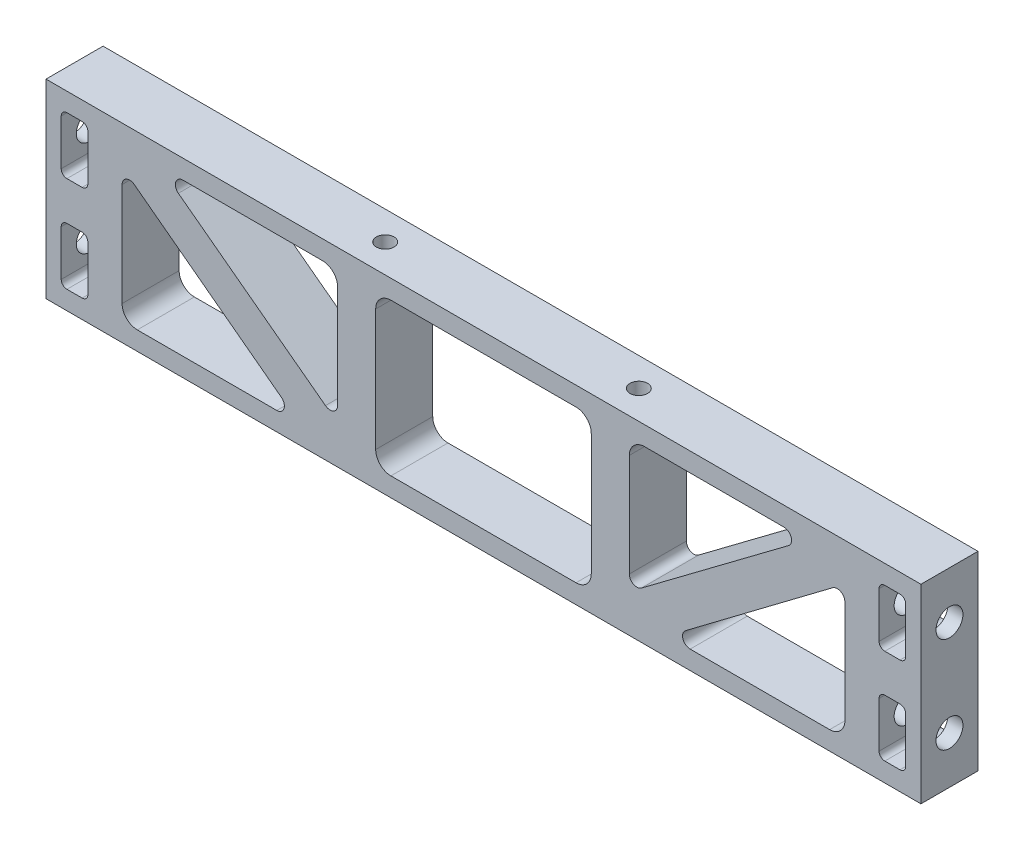
from build123d import *

# Parameters (mm, degrees)
BOSS_EXTRUDE2_DEPTH                        = 9.525
SKETCH3_R                                  = 2.2479
CUT_EXTRUDE1_DEPTH                         = 11.1125
MIRROR1_AT_THE_SECOND_PLANE_COPY_1_SKETC_R = 2.2479
MIRROR1_AT_THE_SECOND_PLANE_COPY_1_DEPTH   = 11.1125
SKETCH4_R                                  = 1.4732
CUT_EXTRUDE2_DEPTH                         = 12.7
MIRROR2_AT_THE_SECOND_PLANE_COPY_1_SKETC_R = 1.4732
MIRROR2_AT_THE_SECOND_PLANE_COPY_1_DEPTH   = 12.7


with BuildPart() as part:
    # Sketch2 → Boss-Extrude2 (new body)
    with BuildSketch(Plane.XY):
        Polygon((-63.5, 15.875), (-73.025, 15.875), (-73.025, -15.875), (-63.5, -15.875), (-21.166666667, -15.875), (0, -15.875), (73.025, -15.875), (73.025, 15.875), (-21.166666667, 15.875), (-24.341666667, 15.875), align=None)
        with BuildLine():
            Line((-66.04, -4.19), (-66.04, -11.81))
            ThreePointArc((-66.04, -11.81), (-66.318980791, -12.483519209), (-66.9925, -12.7625))
            Line((-66.9925, -12.7625), (-69.5325, -12.7625))
            ThreePointArc((-69.5325, -12.7625), (-70.206019209, -12.483519209), (-70.485, -11.81))
            Line((-70.485, -11.81), (-70.485, -4.19))
            ThreePointArc((-70.485, -4.19), (-70.206019209, -3.516480791), (-69.5325, -3.2375))
            Line((-69.5325, -3.2375), (-66.9925, -3.2375))
            ThreePointArc((-66.9925, -3.2375), (-66.318980791, -3.516480791), (-66.04, -4.19))
        make_face(mode=Mode.SUBTRACT)
        with BuildLine():
            ThreePointArc((-57.785, -12.7625), (-59.581051224, -12.018551224), (-60.325, -10.2225))
            Line((-60.325, -10.2225), (-60.325, 6.985))
            ThreePointArc((-60.325, 6.985), (-59.622036939, 8.121384226), (-58.291347858, 7.999758792))
            Line((-58.291347858, 7.999758792), (-33.738014525, -10.477741208))
            ThreePointArc((-33.738014525, -10.477741208), (-33.29716601, -11.895089328), (-34.501666667, -12.7625))
            Line((-34.501666667, -12.7625), (-57.785, -12.7625))
        make_face(mode=Mode.SUBTRACT)
        with BuildLine():
            ThreePointArc((70.485, -11.7475), (70.206019209, -12.421019209), (69.5325, -12.7))
            Line((69.5325, -12.7), (66.9925, -12.7))
            ThreePointArc((66.9925, -12.7), (66.318980791, -12.421019209), (66.04, -11.7475))
            Line((66.04, -11.7475), (66.04, -4.1275))
            ThreePointArc((66.04, -4.1275), (66.318980791, -3.453980791), (66.9925, -3.175))
            Line((66.9925, -3.175), (69.5325, -3.175))
            ThreePointArc((69.5325, -3.175), (70.206019209, -3.453980791), (70.485, -4.1275))
            Line((70.485, -4.1275), (70.485, -11.7475))
        make_face(mode=Mode.SUBTRACT)
        with BuildLine():
            ThreePointArc((60.325, -10.2225), (59.581051224, -12.018551224), (57.785, -12.7625))
            Line((57.785, -12.7625), (34.501666667, -12.7625))
            ThreePointArc((34.501666667, -12.7625), (33.29716601, -11.895089328), (33.738014525, -10.477741208))
            Line((33.738014525, -10.477741208), (58.291347858, 7.999758792))
            ThreePointArc((58.291347858, 7.999758792), (59.622036939, 8.121384226), (60.325, 6.985))
            Line((60.325, 6.985), (60.325, -10.2225))
        make_face(mode=Mode.SUBTRACT)
        with BuildLine():
            Line((-26.373666667, -8.001), (-50.927, 10.414))
            ThreePointArc((-50.927, 10.414), (-51.369827789, 11.831609263), (-50.165, 12.7))
            Line((-50.165, 12.7), (-26.881666667, 12.7))
            ThreePointArc((-26.881666667, 12.7), (-25.085615442, 11.956051224), (-24.341666667, 10.16))
            Line((-24.341666667, 10.16), (-24.341666667, -6.985))
            ThreePointArc((-24.341666667, -6.985), (-25.0437054, -8.120922533), (-26.373666667, -8.001))
        make_face(mode=Mode.SUBTRACT)
        with BuildLine():
            ThreePointArc((-70.485, 11.81), (-70.206019209, 12.483519209), (-69.5325, 12.7625))
            Line((-69.5325, 12.7625), (-66.9925, 12.7625))
            ThreePointArc((-66.9925, 12.7625), (-66.318980791, 12.483519209), (-66.04, 11.81))
            Line((-66.04, 11.81), (-66.04, 4.19))
            ThreePointArc((-66.04, 4.19), (-66.318980791, 3.516480791), (-66.9925, 3.2375))
            Line((-66.9925, 3.2375), (-69.5325, 3.2375))
            ThreePointArc((-69.5325, 3.2375), (-70.206019209, 3.516480791), (-70.485, 4.19))
            Line((-70.485, 4.19), (-70.485, 11.81))
        make_face(mode=Mode.SUBTRACT)
        with BuildLine():
            Line((15.451666667, -12.7), (0, -12.7))
            Line((0, -12.7), (-15.451666667, -12.7))
            ThreePointArc((-15.451666667, -12.7), (-17.247717891, -11.956051224), (-17.991666667, -10.16))
            Line((-17.991666667, -10.16), (-17.991666667, 10.16))
            ThreePointArc((-17.991666667, 10.16), (-17.247717891, 11.956051224), (-15.451666667, 12.7))
            Line((-15.451666667, 12.7), (15.451666667, 12.7))
            ThreePointArc((15.451666667, 12.7), (17.247717891, 11.956051224), (17.991666667, 10.16))
            Line((17.991666667, 10.16), (17.991666667, -10.16))
            ThreePointArc((17.991666667, -10.16), (17.247717891, -11.956051224), (15.451666667, -12.7))
        make_face(mode=Mode.SUBTRACT)
        with BuildLine():
            Line((24.341666667, -6.985), (24.341666667, 10.16))
            ThreePointArc((24.341666667, 10.16), (25.085615442, 11.956051224), (26.881666667, 12.7))
            Line((26.881666667, 12.7), (50.165, 12.7))
            ThreePointArc((50.165, 12.7), (51.369827789, 11.831609263), (50.927, 10.414))
            Line((50.927, 10.414), (26.373666667, -8.001))
            ThreePointArc((26.373666667, -8.001), (25.0437054, -8.120922533), (24.341666667, -6.985))
        make_face(mode=Mode.SUBTRACT)
        with BuildLine():
            Line((66.04, 4.1275), (66.04, 11.7475))
            ThreePointArc((66.04, 11.7475), (66.318980791, 12.421019209), (66.9925, 12.7))
            Line((66.9925, 12.7), (69.5325, 12.7))
            ThreePointArc((69.5325, 12.7), (70.206019209, 12.421019209), (70.485, 11.7475))
            Line((70.485, 11.7475), (70.485, 4.1275))
            ThreePointArc((70.485, 4.1275), (70.206019209, 3.453980791), (69.5325, 3.175))
            Line((69.5325, 3.175), (66.9925, 3.175))
            ThreePointArc((66.9925, 3.175), (66.318980791, 3.453980791), (66.04, 4.1275))
        make_face(mode=Mode.SUBTRACT)
    extrude(amount=BOSS_EXTRUDE2_DEPTH)

    # Sketch3 → Cut-Extrude1 (cut)
    with BuildSketch(Plane.ZY.offset(73.025)):
        with Locations((4.7625, 8)):
            Circle(SKETCH3_R)
    cut_extrude1 = extrude(amount=-CUT_EXTRUDE1_DEPTH, mode=Mode.SUBTRACT)

    # Mirror1: Cut-Extrude1 across plane
    add(cut_extrude1.mirror(Plane(origin=(0, 0, 0), x_dir=(0, 0, 1), z_dir=(1, 0, 0))), mode=Mode.SUBTRACT)

    # Mirror1 at the second plane: Cut-Extrude1 across plane
    add(cut_extrude1.mirror(Plane.ZX), mode=Mode.SUBTRACT)

    # Mirror1 at the second plane copy 1 sketc → Mirror1 at the second plane copy 1 (cut)
    with BuildSketch(Plane(origin=(73.025, 0, 0), x_dir=(0, 0, 1), z_dir=(1, 0, 0))):
        with Locations((4.7625, 8)):
            Circle(MIRROR1_AT_THE_SECOND_PLANE_COPY_1_SKETC_R)
    extrude(amount=-MIRROR1_AT_THE_SECOND_PLANE_COPY_1_DEPTH, mode=Mode.SUBTRACT)

    # Sketch4 → Cut-Extrude2 (cut)
    with BuildSketch(Plane(origin=(0, 15.875, 0), x_dir=(1, 0, 0), z_dir=(0, 1, 0))):
        with Locations((21.166666667, -4.7625)):
            Circle(SKETCH4_R)
    cut_extrude2 = extrude(amount=-CUT_EXTRUDE2_DEPTH, mode=Mode.SUBTRACT)

    # Mirror2: Cut-Extrude2 across plane
    add(cut_extrude2.mirror(Plane.ZX), mode=Mode.SUBTRACT)

    # Mirror2 at the second plane: Cut-Extrude2 across plane
    add(cut_extrude2.mirror(Plane(origin=(0, 0, 0), x_dir=(0, 0, 1), z_dir=(1, 0, 0))), mode=Mode.SUBTRACT)

    # Mirror2 at the second plane copy 1 sketc → Mirror2 at the second plane copy 1 (cut)
    with BuildSketch(Plane(origin=(0, -15.875, 0), x_dir=(-1, 0, 0), z_dir=(0, -1, 0))):
        with Locations((21.166666667, -4.7625)):
            Circle(MIRROR2_AT_THE_SECOND_PLANE_COPY_1_SKETC_R)
    extrude(amount=-MIRROR2_AT_THE_SECOND_PLANE_COPY_1_DEPTH, mode=Mode.SUBTRACT)


solid = part.part
